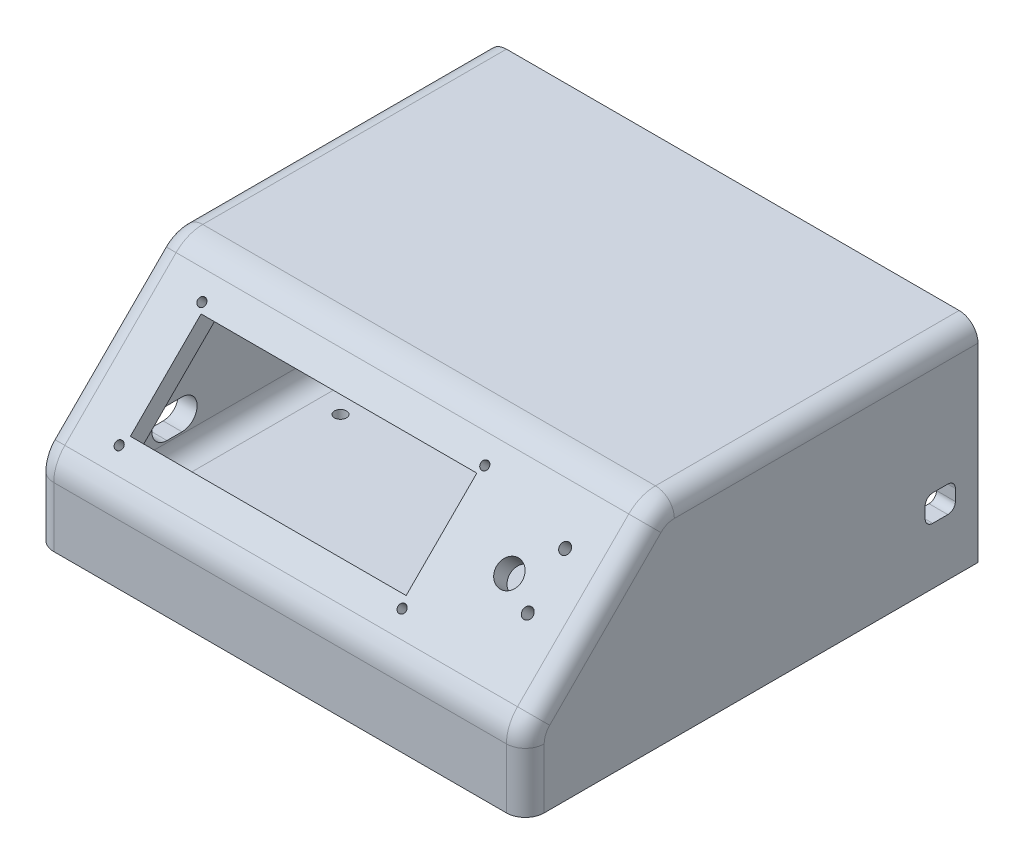
from build123d import *

# Parameters (mm, degrees)
BOSS_EXTRUDE1_DEPTH                                 = 130
SHELL1_T                                            = -5
SKETCH3_R                                           = 3.4
SKETCH3_W                                           = 73.1
SKETCH3_H                                           = 26.5
CUT_EXTRUDE1_DEPTH                                  = 5
FILLET1_R                                           = 10
FILLET2_R                                           = 5
CUT_EXTRUDE2_DEPTH                                  = 5
FILLET3_R                                           = 5
CUT_EXTRUDE3_REACH                                  = 191.36
SKETCH5_R                                           = 1.4
CUT_EXTRUDE4_REACH                                  = 191.36
SKETCH6_R                                           = 1.1
CUT_EXTRUDE5_REACH                                  = 185.945
SKETCH7_R                                           = 1.5
CSK_FOR_M3_COUNTERSUNK_FLAT_HEAD_SCREW2_D           = 3.2
CSK_FOR_M3_COUNTERSUNK_FLAT_HEAD_SCREW2_DEPTH       = 8
CSK_FOR_M3_COUNTERSUNK_FLAT_HEAD_SCREW2_CSINK_D     = 6.3
CSK_FOR_M3_COUNTERSUNK_FLAT_HEAD_SCREW2_CSINK_ANGLE = 90
CSK_FOR_M3_COUNTERSUNK_FLAT_HEAD_SCREW2_TIP         = 0.96137699
CUT_EXTRUDE6_REACH                                  = 187.376
SKETCH15_R                                          = 1.2
CUT_EXTRUDE7_DEPTH                                  = 20
SKETCH16_R                                          = 1.2
BOSS_EXTRUDE2_DEPTH                                 = 5
CSK_FOR_M3_COUNTERSUNK_FLAT_HEAD_SCR_2_COUNT        = 2
CSK_FOR_M3_COUNTERSUNK_FLAT_HEAD_SCR_2_PITCH        = 47.355339059
CSK_FOR_M3_COUNTERSUNK_FLAT_HEAD_SCR_3_COUNT        = 2
CSK_FOR_M3_COUNTERSUNK_FLAT_HEAD_SCR_3_PITCH        = 122
CSK_FOR_M3_COUNTERSUNK_FLAT_HEAD_SCR_4_COUNT        = 2
CSK_FOR_M3_COUNTERSUNK_FLAT_HEAD_SCR_4_PITCH        = 130.868361866


with BuildPart() as part:
    # Sketch2 → Boss-Extrude1 (new body)
    with BuildSketch(Plane(origin=(0, 0, 0), x_dir=(0, 0, -1), z_dir=(1, 0, 0))):
        Polygon((0, 0), (0, 20), (35.355339059, 55.355339059), (120, 55.355339059), (120, 0), align=None)
    extrude(amount=BOSS_EXTRUDE1_DEPTH)

    # Shell1
    shell1_openings = [part.faces().sort_by_distance(p)[0] for p in [
        (65, 27.67766953, -120),
    ]]
    offset(amount=SHELL1_T, openings=shell1_openings, kind=Kind.INTERSECTION)

    # Sketch3 → Cut-Extrude1 (cut)
    with BuildSketch(Plane(origin=(0, 10, 10), x_dir=(1, 0, 0), z_dir=(0, 0.7071067811865486, 0.7071067811865465))):
        with Locations(Location((108.1, 39.142135624, 0), (0, 0, 270))):
            Circle(SKETCH3_R)
        with Locations((53.55, 39.142135624)):
            Rectangle(SKETCH3_W, SKETCH3_H)
    extrude(amount=-CUT_EXTRUDE1_DEPTH, mode=Mode.SUBTRACT)

    # Fillet1
    # the kernel refuses this fillet: 10 mm, written as the material it adds along each edge
    with BuildSketch(Plane(origin=(125, 50.355339059, -37.426406871), x_dir=(0, 0, -1), z_dir=(-1, 0, 0)), Plane(origin=(125, 17.928932188, -5), x_dir=(0, 0.7071067811865465, -0.7071067811865486), z_dir=(-1, 0, 0))) as fillet1_piece_1:
        with BuildLine():
            CenterArc((FILLET1_R * 0.414213562373, FILLET1_R), FILLET1_R, 225, 45)
            Line((-FILLET1_R * 0.292893218813, FILLET1_R * 0.292893218813), (0, 0))
            Line((0, 0), (FILLET1_R * 0.414213562373, 0))
        make_face()
    extrude(amount=120)
    with BuildSketch(Plane(origin=(5, 5, -5), x_dir=(0, 0, -1), z_dir=(1, 0, 0))) as fillet1_piece_2:
        with BuildLine():
            CenterArc((FILLET1_R, FILLET1_R), FILLET1_R, 180, 90)
            Line((0, FILLET1_R), (0, 0))
            Line((0, 0), (FILLET1_R, 0))
        make_face()
    extrude(amount=120)
    # the kernel refuses this fillet: 10 mm, written as the material it takes off along each edge
    with BuildSketch(Plane(origin=(-10.355339059, 20, 0), x_dir=(0, -1, 0), z_dir=(1, 0, 0)), Plane(origin=(-10.355339059, 55.355339059, -35.355339059), x_dir=(0, -0.7071067811865476, 0.7071067811865476), z_dir=(1, 0, 0))) as fillet1_2_piece_1:
        with BuildLine():
            CenterArc((FILLET1_R * 0.414213562373, FILLET1_R), FILLET1_R, 225, 45)
            Line((-FILLET1_R * 0.292893218813, FILLET1_R * 0.292893218813), (0, 0))
            Line((0, 0), (FILLET1_R * 0.414213562373, 0))
        make_face()
    extrude(amount=150.710678119, mode=Mode.SUBTRACT)

    # Fillet2
    fillet2_edges = [part.edges().sort_by_distance(p)[0] for p in [
        (130, 55.355339059, -79.748737342),
        (0, 7.928932188, 0),
        (130, 7.928932188, 0),
        (0, 37.67766953, -17.67766953),
        (0, 54.594134384, -35.670640359),
        (0, 19.6846987, -0.761204675),
        (130, 37.67766953, -17.67766953),
        (130, 54.594134384, -35.670640359),
        (130, 19.6846987, -0.761204675),
        (0, 55.355339059, -79.748737342),
    ]]
    fillet(fillet2_edges, radius=FILLET2_R)

    # Sketch4 → Cut-Extrude2 (cut)
    with BuildSketch(Plane(origin=(130, 0, 0), x_dir=(0, 0, -1), z_dir=(1, 0, 0))):
        with BuildLine():
            Line((108, 22), (112, 22))
            ThreePointArc((112, 22), (113.414213562, 21.414213562), (114, 20))
            Line((114, 20), (114, 17))
            ThreePointArc((114, 17), (113.414213562, 15.585786438), (112, 15))
            Line((112, 15), (108, 15))
            ThreePointArc((108, 15), (106.585786438, 15.585786438), (106, 17))
            Line((106, 17), (106, 20))
            ThreePointArc((106, 20), (106.585786438, 21.414213562), (108, 22))
        make_face()
    extrude(amount=-CUT_EXTRUDE2_DEPTH, mode=Mode.SUBTRACT)

    # Fillet3
    # the kernel refuses this fillet: 5 mm, written as the material it adds along each edge
    with BuildSketch(Plane(origin=(5, 50.355339059, -120), x_dir=(1, 0, 0), z_dir=(0, 0, 1))) as fillet3_piece_1:
        with BuildLine():
            CenterArc((FILLET3_R, -FILLET3_R), FILLET3_R, 90, 90)
            Line((0, -FILLET3_R), (0, 0))
            Line((0, 0), (FILLET3_R, 0))
        make_face()
    fillet3_piece_1_solid = extrude(amount=78.431457505, mode=Mode.PRIVATE)
    with BuildSketch(Plane(origin=(125, 50.355339059, -120), x_dir=(-1, 0, 0), z_dir=(0, 0, 1))) as fillet3_piece_2:
        with BuildLine():
            CenterArc((FILLET3_R, FILLET3_R), FILLET3_R, 180, 90)
            Line((0, FILLET3_R), (0, 0))
            Line((0, 0), (FILLET3_R, 0))
        make_face()
    fillet3_piece_2_solid = extrude(amount=78.431457505, mode=Mode.PRIVATE)
    with BuildSketch(Plane(origin=(5, 5, -15), x_dir=(0, 1, 0), z_dir=(0, 0, -1)), Plane(origin=(125, 5, -15), x_dir=(-1, 0, 0), z_dir=(0, 0, -1))) as fillet3_piece_3:
        with BuildLine():
            CenterArc((FILLET3_R, FILLET3_R), FILLET3_R, 180, 90)
            Line((0, FILLET3_R), (0, 0))
            Line((0, 0), (FILLET3_R, 0))
        make_face()
    fillet3_piece_3_solid = extrude(amount=105, mode=Mode.PRIVATE)
    with BuildSketch(Plane(origin=(5, 47.426406871, -34.497474683), x_dir=(0, -0.7071067811865487, -0.7071067811865464), z_dir=(0, -0.7071067811865465, 0.7071067811865487))) as fillet3_piece_4:
        with BuildLine():
            CenterArc((FILLET3_R, FILLET3_R), FILLET3_R, 180, 90)
            Line((0, FILLET3_R), (0, 0))
            Line((0, 0), (FILLET3_R, 0))
        make_face()
    fillet3_piece_4_solid = extrude(amount=37.573593129, mode=Mode.PRIVATE)
    with BuildSketch(Plane(origin=(5, 13.786796564, -15), x_dir=(0, -0.9281493111658919, 0.3722080818336436), z_dir=(0, -0.3722080818336436, -0.9281493111658919))) as fillet3_piece_5:
        with BuildLine():
            CenterArc((10 - FILLET3_R, -FILLET3_R), FILLET3_R, 0, 90)
            Line((10, -FILLET3_R), (10, 0))
            Line((10, 0), (10 - FILLET3_R, 0))
        make_face()
    fillet3_piece_5_solid = revolve(axis=Axis((5, 13.786796564, -15), (-1, 0, 0)), revolution_arc=113.148139986, mode=Mode.PRIVATE)
    with BuildSketch(Plane(origin=(5, 15, -15), x_dir=(0, 0.9282822091618541, 0.37187651196813665), z_dir=(0, 0.37187651196813665, -0.9282822091618541))) as fillet3_piece_6:
        with BuildLine():
            CenterArc((10 - FILLET3_R, FILLET3_R), FILLET3_R, 270, 90)
            Line((10, FILLET3_R), (10, 0))
            Line((10, 0), (10 - FILLET3_R, 0))
        make_face()
    fillet3_piece_6_solid = revolve(axis=Axis((5, 15, -15), (1, 0, 0)), revolution_arc=158.168606729, mode=Mode.PRIVATE)
    with BuildSketch(Plane(origin=(5, 40.355339059, -41.568542495), x_dir=(0, 0.7071067811865476, 0.7071067811865476), z_dir=(0, -0.7071067811865476, 0.7071067811865476))) as fillet3_piece_7:
        with BuildLine():
            CenterArc((10 - FILLET3_R, -FILLET3_R), FILLET3_R, 0, 90)
            Line((10, -FILLET3_R), (10, 0))
            Line((10, 0), (10 - FILLET3_R, 0))
        make_face()
    fillet3_piece_7_solid = revolve(axis=Axis((5, 40.355339059, -41.568542495), (-1, 0, 0)), revolution_arc=45, mode=Mode.PRIVATE)
    with BuildSketch(Plane(origin=(125, 47.426406871, -34.497474683), x_dir=(-2.842170943040401e-15, -0.7071067811865487, -0.7071067811865464), z_dir=(0, -0.7071067811865465, 0.7071067811865487))) as fillet3_piece_8:
        with BuildLine():
            CenterArc((FILLET3_R, -FILLET3_R), FILLET3_R, 90, 90)
            Line((0, -FILLET3_R), (0, 0))
            Line((0, 0), (FILLET3_R, 0))
        make_face()
    fillet3_piece_8_solid = extrude(amount=37.573593129, mode=Mode.PRIVATE)
    with BuildSketch(Plane(origin=(125, 13.786796564, -15), x_dir=(0, -0.9281493111658919, 0.3722080818336436), z_dir=(0, -0.3722080818336436, -0.9281493111658919))) as fillet3_piece_9:
        with BuildLine():
            CenterArc((10 - FILLET3_R, FILLET3_R), FILLET3_R, 270, 90)
            Line((10, FILLET3_R), (10, 0))
            Line((10, 0), (10 - FILLET3_R, 0))
        make_face()
    fillet3_piece_9_solid = revolve(axis=Axis((125, 13.786796564, -15), (-1, 0, 0)), revolution_arc=113.148139986, mode=Mode.PRIVATE)
    with BuildSketch(Plane(origin=(125, 15, -15), x_dir=(0, 0.9282822091618541, 0.37187651196813665), z_dir=(0, 0.37187651196813665, -0.9282822091618541))) as fillet3_piece_10:
        with BuildLine():
            CenterArc((10 - FILLET3_R, -FILLET3_R), FILLET3_R, 0, 90)
            Line((10, -FILLET3_R), (10, 0))
            Line((10, 0), (10 - FILLET3_R, 0))
        make_face()
    fillet3_piece_10_solid = revolve(axis=Axis((125, 15, -15), (1, 0, 0)), revolution_arc=158.168606729, mode=Mode.PRIVATE)
    with BuildSketch(Plane(origin=(125, 40.355339059, -41.568542495), x_dir=(0, 0.7071067811865476, 0.7071067811865476), z_dir=(0, -0.7071067811865476, 0.7071067811865476))) as fillet3_piece_11:
        with BuildLine():
            CenterArc((10 - FILLET3_R, FILLET3_R), FILLET3_R, 270, 90)
            Line((10, FILLET3_R), (10, 0))
            Line((10, 0), (10 - FILLET3_R, 0))
        make_face()
    fillet3_piece_11_solid = revolve(axis=Axis((125, 40.355339059, -41.568542495), (-1, 0, 0)), revolution_arc=45, mode=Mode.PRIVATE)
    add([fillet3_piece_1_solid, fillet3_piece_2_solid, fillet3_piece_3_solid, fillet3_piece_4_solid, fillet3_piece_5_solid, fillet3_piece_6_solid, fillet3_piece_7_solid, fillet3_piece_8_solid, fillet3_piece_9_solid, fillet3_piece_10_solid, fillet3_piece_11_solid])

    # Sketch5 → Cut-Extrude3 (cut, up to next)
    with BuildSketch(Plane(origin=(0, 10, 10), x_dir=(1, 0, 0), z_dir=(0, 0.7071067811865486, 0.7071067811865465)), mode=Mode.PRIVATE) as cut_extrude3_sk1:
        with Locations(Location((116.3, 48.442135624, 0), (0, 0, 270))):
            Circle(SKETCH5_R)
    cut_extrude3_tool1 = extrude(cut_extrude3_sk1.sketch, amount=-CUT_EXTRUDE3_REACH, mode=Mode.PRIVATE) & part.part
    # Sketch5 → Cut-Extrude3 (cut, up to next)
    with BuildSketch(Plane(origin=(0, 10, 10), x_dir=(1, 0, 0), z_dir=(0, 0.7071067811865486, 0.7071067811865465)), mode=Mode.PRIVATE) as cut_extrude3_sk2:
        with Locations(Location((116.3, 34.442135624, 0), (0, 0, 270))):
            Circle(SKETCH5_R)
    cut_extrude3_tool2 = extrude(cut_extrude3_sk2.sketch, amount=-CUT_EXTRUDE3_REACH, mode=Mode.PRIVATE) & part.part
    add(cut_extrude3_tool1.solids().sort_by_distance((116.3, 44.253763, -24.253763))[0], mode=Mode.SUBTRACT)
    add(cut_extrude3_tool2.solids().sort_by_distance((116.3, 34.354268, -14.354268))[0], mode=Mode.SUBTRACT)

    # Sketch6 → Cut-Extrude4 (cut, up to next)
    with BuildSketch(Plane(origin=(0, 10, 10), x_dir=(1, 0, 0), z_dir=(0, 0.7071067811865486, 0.7071067811865465)), mode=Mode.PRIVATE) as cut_extrude4_sk1:
        with Locations(Location((15.8, 54.392135624, 0), (0, 0, 270))):
            Circle(SKETCH6_R)
    cut_extrude4_tool1 = extrude(cut_extrude4_sk1.sketch, amount=-CUT_EXTRUDE4_REACH, mode=Mode.PRIVATE) & part.part
    # Sketch6 → Cut-Extrude4 (cut, up to next)
    with BuildSketch(Plane(origin=(0, 10, 10), x_dir=(1, 0, 0), z_dir=(0, 0.7071067811865486, 0.7071067811865465)), mode=Mode.PRIVATE) as cut_extrude4_sk2:
        with Locations(Location((90.8, 54.392135624, 0), (0, 0, 270))):
            Circle(SKETCH6_R)
    cut_extrude4_tool2 = extrude(cut_extrude4_sk2.sketch, amount=-CUT_EXTRUDE4_REACH, mode=Mode.PRIVATE) & part.part
    # Sketch6 → Cut-Extrude4 (cut, up to next)
    with BuildSketch(Plane(origin=(0, 10, 10), x_dir=(1, 0, 0), z_dir=(0, 0.7071067811865486, 0.7071067811865465)), mode=Mode.PRIVATE) as cut_extrude4_sk3:
        with Locations(Location((90.8, 23.392135624, 0), (0, 0, 270))):
            Circle(SKETCH6_R)
    cut_extrude4_tool3 = extrude(cut_extrude4_sk3.sketch, amount=-CUT_EXTRUDE4_REACH, mode=Mode.PRIVATE) & part.part
    # Sketch6 → Cut-Extrude4 (cut, up to next)
    with BuildSketch(Plane(origin=(0, 10, 10), x_dir=(1, 0, 0), z_dir=(0, 0.7071067811865486, 0.7071067811865465)), mode=Mode.PRIVATE) as cut_extrude4_sk4:
        with Locations(Location((15.8, 23.392135624, 0), (0, 0, 270))):
            Circle(SKETCH6_R)
    cut_extrude4_tool4 = extrude(cut_extrude4_sk4.sketch, amount=-CUT_EXTRUDE4_REACH, mode=Mode.PRIVATE) & part.part
    add(cut_extrude4_tool1.solids().sort_by_distance((15.8, 48.461048, -28.461048))[0], mode=Mode.SUBTRACT)
    add(cut_extrude4_tool2.solids().sort_by_distance((90.8, 48.461048, -28.461048))[0], mode=Mode.SUBTRACT)
    add(cut_extrude4_tool3.solids().sort_by_distance((90.8, 26.540738, -6.540738))[0], mode=Mode.SUBTRACT)
    add(cut_extrude4_tool4.solids().sort_by_distance((15.8, 26.540738, -6.540738))[0], mode=Mode.SUBTRACT)

    # Sketch7 → Cut-Extrude5 (cut, up to next)
    with BuildSketch(Plane(origin=(0, 5, 0), x_dir=(1, 0, 0), z_dir=(0, 1, 0)), mode=Mode.PRIVATE) as cut_extrude5_sk1:
        with Locations(Location((16.5, 21.5, 0), (0, 0, 270))):
            Circle(SKETCH7_R)
    cut_extrude5_tool1 = extrude(cut_extrude5_sk1.sketch, amount=-CUT_EXTRUDE5_REACH, mode=Mode.PRIVATE) & part.part
    # Sketch7 → Cut-Extrude5 (cut, up to next)
    with BuildSketch(Plane(origin=(0, 5, 0), x_dir=(1, 0, 0), z_dir=(0, 1, 0)), mode=Mode.PRIVATE) as cut_extrude5_sk2:
        with Locations(Location((16.5, 64.5, 0), (0, 0, 270))):
            Circle(SKETCH7_R)
    cut_extrude5_tool2 = extrude(cut_extrude5_sk2.sketch, amount=-CUT_EXTRUDE5_REACH, mode=Mode.PRIVATE) & part.part
    # Sketch7 → Cut-Extrude5 (cut, up to next)
    with BuildSketch(Plane(origin=(0, 5, 0), x_dir=(1, 0, 0), z_dir=(0, 1, 0)), mode=Mode.PRIVATE) as cut_extrude5_sk3:
        with Locations(Location((109.5, 21.5, 0), (0, 0, 270))):
            Circle(SKETCH7_R)
    cut_extrude5_tool3 = extrude(cut_extrude5_sk3.sketch, amount=-CUT_EXTRUDE5_REACH, mode=Mode.PRIVATE) & part.part
    # Sketch7 → Cut-Extrude5 (cut, up to next)
    with BuildSketch(Plane(origin=(0, 5, 0), x_dir=(1, 0, 0), z_dir=(0, 1, 0)), mode=Mode.PRIVATE) as cut_extrude5_sk4:
        with Locations(Location((109.5, 64.5, 0), (0, 0, 270))):
            Circle(SKETCH7_R)
    cut_extrude5_tool4 = extrude(cut_extrude5_sk4.sketch, amount=-CUT_EXTRUDE5_REACH, mode=Mode.PRIVATE) & part.part
    # Sketch7 → Cut-Extrude5 (cut, up to next)
    with BuildSketch(Plane(origin=(0, 5, 0), x_dir=(1, 0, 0), z_dir=(0, 1, 0)), mode=Mode.PRIVATE) as cut_extrude5_sk5:
        with Locations(Location((109, 79, 0), (0, 0, 270))):
            Circle(SKETCH7_R)
    cut_extrude5_tool5 = extrude(cut_extrude5_sk5.sketch, amount=-CUT_EXTRUDE5_REACH, mode=Mode.PRIVATE) & part.part
    # Sketch7 → Cut-Extrude5 (cut, up to next)
    with BuildSketch(Plane(origin=(0, 5, 0), x_dir=(1, 0, 0), z_dir=(0, 1, 0)), mode=Mode.PRIVATE) as cut_extrude5_sk6:
        with Locations(Location((53, 79, 0), (0, 0, 270))):
            Circle(SKETCH7_R)
    cut_extrude5_tool6 = extrude(cut_extrude5_sk6.sketch, amount=-CUT_EXTRUDE5_REACH, mode=Mode.PRIVATE) & part.part
    # Sketch7 → Cut-Extrude5 (cut, up to next)
    with BuildSketch(Plane(origin=(0, 5, 0), x_dir=(1, 0, 0), z_dir=(0, 1, 0)), mode=Mode.PRIVATE) as cut_extrude5_sk7:
        with Locations(Location((53, 115, 0), (0, 0, 270))):
            Circle(SKETCH7_R)
    cut_extrude5_tool7 = extrude(cut_extrude5_sk7.sketch, amount=-CUT_EXTRUDE5_REACH, mode=Mode.PRIVATE) & part.part
    # Sketch7 → Cut-Extrude5 (cut, up to next)
    with BuildSketch(Plane(origin=(0, 5, 0), x_dir=(1, 0, 0), z_dir=(0, 1, 0)), mode=Mode.PRIVATE) as cut_extrude5_sk8:
        with Locations(Location((109, 115, 0), (0, 0, 270))):
            Circle(SKETCH7_R)
    cut_extrude5_tool8 = extrude(cut_extrude5_sk8.sketch, amount=-CUT_EXTRUDE5_REACH, mode=Mode.PRIVATE) & part.part
    add(cut_extrude5_tool1.solids().sort_by_distance((16.5, 5, -21.5))[0], mode=Mode.SUBTRACT)
    add(cut_extrude5_tool2.solids().sort_by_distance((16.5, 5, -64.5))[0], mode=Mode.SUBTRACT)
    add(cut_extrude5_tool3.solids().sort_by_distance((109.5, 5, -21.5))[0], mode=Mode.SUBTRACT)
    add(cut_extrude5_tool4.solids().sort_by_distance((109.5, 5, -64.5))[0], mode=Mode.SUBTRACT)
    add(cut_extrude5_tool5.solids().sort_by_distance((109, 5, -79))[0], mode=Mode.SUBTRACT)
    add(cut_extrude5_tool6.solids().sort_by_distance((53, 5, -79))[0], mode=Mode.SUBTRACT)
    add(cut_extrude5_tool7.solids().sort_by_distance((53, 5, -115))[0], mode=Mode.SUBTRACT)
    add(cut_extrude5_tool8.solids().sort_by_distance((109, 5, -115))[0], mode=Mode.SUBTRACT)

    # CSK for M3 Countersunk Flat Head Screw2
    with Locations(Plane(origin=(0, 0, 0), x_dir=(-1, 0, 0), z_dir=(0, -1, 0))):
        with Locations((-109, 115), (-53, 115), (-53, 79), (-109, 79), (-16.5, 64.5), (-16.5, 21.5), (-109.5, 21.5), (-109.5, 64.5)):
            CounterSinkHole(CSK_FOR_M3_COUNTERSUNK_FLAT_HEAD_SCREW2_D / 2, CSK_FOR_M3_COUNTERSUNK_FLAT_HEAD_SCREW2_CSINK_D / 2, depth=CSK_FOR_M3_COUNTERSUNK_FLAT_HEAD_SCREW2_DEPTH, counter_sink_angle=CSK_FOR_M3_COUNTERSUNK_FLAT_HEAD_SCREW2_CSINK_ANGLE)
            with Locations((0, 0, -(CSK_FOR_M3_COUNTERSUNK_FLAT_HEAD_SCREW2_DEPTH + CSK_FOR_M3_COUNTERSUNK_FLAT_HEAD_SCREW2_TIP / 2))):  # 118° drill point
                Cone(0, CSK_FOR_M3_COUNTERSUNK_FLAT_HEAD_SCREW2_D / 2, CSK_FOR_M3_COUNTERSUNK_FLAT_HEAD_SCREW2_TIP, mode=Mode.SUBTRACT)

    # Sketch14 → Cut-Extrude6 (cut, up to next)
    with BuildSketch(Plane.ZY, mode=Mode.PRIVATE) as cut_extrude6_sk1:
        with BuildLine():
            Line((-34, 18.5), (-30, 18.5))
            ThreePointArc((-30, 18.5), (-26, 14.5), (-30, 10.5))
            Line((-30, 10.5), (-34, 10.5))
            ThreePointArc((-34, 10.5), (-38, 14.5), (-34, 18.5))
        make_face()
    cut_extrude6_tool1 = extrude(cut_extrude6_sk1.sketch, amount=-CUT_EXTRUDE6_REACH, mode=Mode.PRIVATE) & part.part
    add(cut_extrude6_tool1.solids().sort_by_distance((0, 14.5, -32))[0], mode=Mode.SUBTRACT)

    # Sketch15 → Cut-Extrude7 (cut)
    with BuildSketch(Plane(origin=(0, 0, -120), x_dir=(-1, 0, 0), z_dir=(0, 0, -1))):
        with Locations((-126, 51.355339059)):
            Circle(SKETCH15_R)
        with Locations((-126, 4)):
            Circle(SKETCH15_R)
        with Locations((-4, 4)):
            Circle(SKETCH15_R)
        with Locations((-4, 51.355339059)):
            Circle(SKETCH15_R)
    extrude(amount=-CUT_EXTRUDE7_DEPTH, mode=Mode.SUBTRACT)


with BuildPart() as body_2:
    # Sketch16 → Boss-Extrude2 (new body)
    with BuildSketch(Plane(origin=(0, 0, -120), x_dir=(-1, 0, 0), z_dir=(0, 0, -1))):
        with BuildLine():
            Line((0, 0), (0, 50.355339059))
            ThreePointArc((0, 50.355339059), (-1.464466094, 53.890872965), (-5, 55.355339059))
            Line((-5, 55.355339059), (-125, 55.355339059))
            ThreePointArc((-125, 55.355339059), (-128.535533906, 53.890872965), (-130, 50.355339059))
            Line((-130, 50.355339059), (-130, 0))
            Line((-130, 0), (0, 0))
        make_face()
        with Locations((-126, 4)):
            Circle(SKETCH16_R, mode=Mode.SUBTRACT)
        with Locations((-4, 4)):
            Circle(SKETCH16_R, mode=Mode.SUBTRACT)
        with Locations((-4, 51.355339059)):
            Circle(SKETCH16_R, mode=Mode.SUBTRACT)
        with Locations((-126, 51.355339059)):
            Circle(SKETCH16_R, mode=Mode.SUBTRACT)
    extrude(amount=BOSS_EXTRUDE2_DEPTH)

    # Sketch20 → CSK for M3 Countersunk Flat Head Screw3 (revolve, cut)
    with BuildSketch(Plane(origin=(126, 51.355339059, -125), x_dir=(0, 1, 0), z_dir=(1, 0, 0))):
        Polygon((0, 0), (0, 8.96137699), (1.6, 8), (1.6, 1.55), (3.15, 0), align=None)
    csk_for_m3_countersunk_flat_head_screw3 = revolve(axis=Axis((126, 51.355339059, -131.35), (0, 0, 1)), mode=Mode.SUBTRACT)

    # CSK for M3 Countersunk Flat Head Scr 2: CSK for M3 Countersunk Flat Head Screw3 ×2
    with Locations(*[(0, -i * CSK_FOR_M3_COUNTERSUNK_FLAT_HEAD_SCR_2_PITCH, 0) for i in range(1, CSK_FOR_M3_COUNTERSUNK_FLAT_HEAD_SCR_2_COUNT)]):
        add(csk_for_m3_countersunk_flat_head_screw3, mode=Mode.SUBTRACT)

    # CSK for M3 Countersunk Flat Head Scr 3: CSK for M3 Countersunk Flat Head Screw3 ×2
    with Locations(*[(-i * CSK_FOR_M3_COUNTERSUNK_FLAT_HEAD_SCR_3_PITCH, 0, 0) for i in range(1, CSK_FOR_M3_COUNTERSUNK_FLAT_HEAD_SCR_3_COUNT)]):
        add(csk_for_m3_countersunk_flat_head_screw3, mode=Mode.SUBTRACT)

    # CSK for M3 Countersunk Flat Head Scr 4: CSK for M3 Countersunk Flat Head Screw3 ×2
    with Locations(*[Vector(-0.9322344855600483, -0.3618547552991284, 0) * (i * CSK_FOR_M3_COUNTERSUNK_FLAT_HEAD_SCR_4_PITCH) for i in range(1, CSK_FOR_M3_COUNTERSUNK_FLAT_HEAD_SCR_4_COUNT)]):
        add(csk_for_m3_countersunk_flat_head_screw3, mode=Mode.SUBTRACT)


solid = part.part
